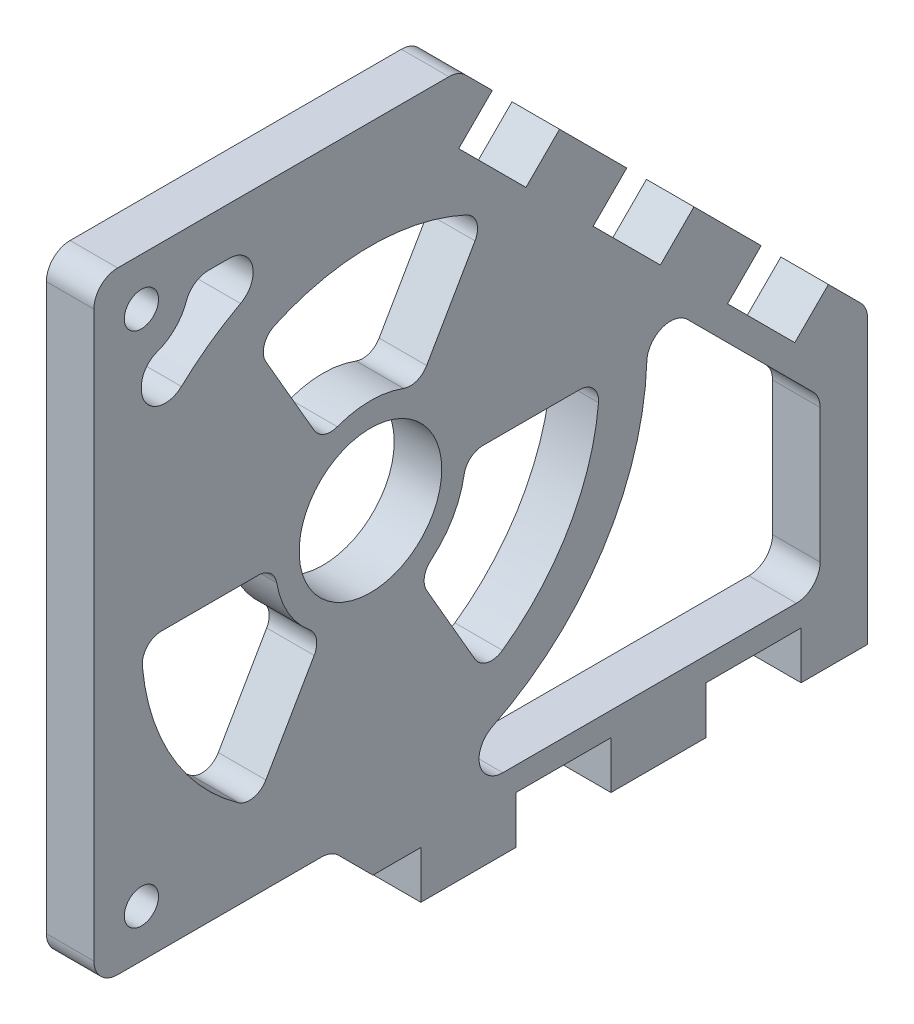
from build123d import *

# Parameters (mm, degrees)
SKETCH2_R           = 2.286
MAIN_DEPTH          = 6.35
SKETCH5_W           = 12.7
SKETCH5_H           = 6.35
SKETCH5_H_2         = 35.219317332
ACRYLIC_JOINT_DEPTH = 123.31992325
SKETCH6_W           = 3.81
SKETCH6_H           = 39.029317332
CUT_EXTRUDE1_DEPTH  = 123.31992325
FILLET4_R           = 3.175
SKETCH7_R           = 9.525
CUT_EXTRUDE2_DEPTH  = 123.31992325
FILLET5_R           = 2.54
CUT_EXTRUDE3_DEPTH  = 123.31992325
FILLET6_R           = 3.175


with BuildPart() as part:
    # Sketch2 → Main (new body)
    with BuildSketch(Plane(origin=(0, 0, 0), x_dir=(0, 0, -1), z_dir=(1, 0, 0))):
        Polygon((-67.818, 101.6), (-67.818, 19.812), (-36.068, 19.812), (-29.718, 13.462), (-29.718, 7.9375), (-24.1935, 7.9375), (45.72, 7.9375), (52.07, 7.9375), (52.07, 30.456817332), (-19.073182668, 101.6), (-55.118, 101.6), align=None)
        with Locations((-61.468, 26.162)):
            Circle(SKETCH2_R, mode=Mode.SUBTRACT)
        with Locations((-61.468, 95.25)):
            Circle(SKETCH2_R, mode=Mode.SUBTRACT)
    extrude(amount=MAIN_DEPTH)

    # Sketch5 → Acrylic Joint (cut, through all)
    with BuildSketch(Plane(origin=(6.35, 0, 0), x_dir=(0, 0, -1), z_dir=(1, 0, 0))):
        with Locations((-30.48, 11.1125)):
            Rectangle(SKETCH5_W, SKETCH5_H)
        with Locations((-5.08, 11.1125)):
            Rectangle(SKETCH5_W, SKETCH5_H)
        with Locations((20.32, 11.1125)):
            Rectangle(SKETCH5_W, SKETCH5_H)
        Polygon((16.847841816, 56.698719395), (21.337969877, 61.188847455), (30.318225998, 52.208591334), (25.828097937, 47.718463274), align=None)
        Polygon((-1.112670426, 74.659231637), (3.377457634, 79.149359697), (12.357713756, 70.169103576), (7.867585695, 65.678975516), align=None)
        Polygon((-19.073182668, 92.619743879), (-14.583054608, 97.109871939), (-5.602798487, 88.129615818), (-10.092926547, 83.639487758), align=None)
        with Locations((45.72, 25.547158666)):
            Rectangle(SKETCH5_W, SKETCH5_H_2)
    extrude(amount=-ACRYLIC_JOINT_DEPTH, mode=Mode.SUBTRACT)

    # Sketch6 → Cut-Extrude1 (cut, through all)
    with BuildSketch(Plane(origin=(6.35, 0, 0), x_dir=(0, 0, -1), z_dir=(1, 0, 0))):
        with Locations((37.465, 27.452158666)):
            Rectangle(SKETCH6_W, SKETCH6_H)
    extrude(amount=-CUT_EXTRUDE1_DEPTH, mode=Mode.SUBTRACT)

    # Fillet4
    fillet4_edges = [part.edges().sort_by_distance(p)[0] for p in [
        (3.175, 101.6, 67.818),
        (3.175, 19.812, 67.818),
        (3.175, 19.812, 36.068),
        (3.175, 101.6, 19.073182668),
        (3.175, 46.966817332, -35.56),
    ]]
    fillet(fillet4_edges, radius=FILLET4_R)

    # Sketch7 → Cut-Extrude2 (cut, through all)
    with BuildSketch(Plane(origin=(6.35, 0, 0), x_dir=(0, 0, -1), z_dir=(1, 0, 0))):
        with Locations((-30.869322709, 56.652691443)):
            Circle(SKETCH7_R)
        with BuildLine():
            Line((-46.168661354, 83.151923299), (-37.219322709, 67.651214071))
            ThreePointArc((-37.219322709, 67.651214071), (-30.869322709, 69.352691443), (-24.519322709, 67.651214071))
            Line((-24.519322709, 67.651214071), (-15.569984063, 83.151923299))
            ThreePointArc((-15.569984063, 83.151923299), (-30.869322709, 87.251368734), (-46.168661354, 83.151923299))
        make_face()
        with BuildLine():
            Line((-18.169322709, 56.652691443), (-0.270645417, 56.652691443))
            ThreePointArc((-0.270645417, 56.652691443), (-4.370090852, 41.353352797), (-15.569984063, 30.153459586))
            Line((-15.569984063, 30.153459586), (-24.519322709, 45.654168815))
            ThreePointArc((-24.519322709, 45.654168815), (-19.870800081, 50.302691443), (-18.169322709, 56.652691443))
        make_face()
        with BuildLine():
            Line((-46.168661354, 30.153459586), (-37.219322709, 45.654168815))
            ThreePointArc((-37.219322709, 45.654168815), (-41.867845337, 50.302691443), (-43.569322709, 56.652691443))
            Line((-43.569322709, 56.652691443), (-61.468, 56.652691443))
            ThreePointArc((-61.468, 56.652691443), (-57.368554565, 41.353352797), (-46.168661354, 30.153459586))
        make_face()
    extrude(amount=-CUT_EXTRUDE2_DEPTH, mode=Mode.SUBTRACT)

    # Fillet5
    fillet5_edges = [part.edges().sort_by_distance(p)[0] for p in [
        (3.175, 56.652691443, 0.270645417),
        (3.175, 83.151923299, 15.569984063),
        (3.175, 45.654168815, 37.219322709),
        (3.175, 56.652691443, 43.569322709),
        (3.175, 30.153459586, 46.168661354),
        (3.175, 30.153459586, 15.569984063),
        (3.175, 67.651214071, 24.519322709),
        (3.175, 67.651214071, 37.219322709),
        (3.175, 45.654168815, 24.519322709),
        (3.175, 56.652691443, 18.169322709),
        (3.175, 56.652691443, 61.468),
        (3.175, 83.151923299, 46.168661354),
    ]]
    fillet(fillet5_edges, radius=FILLET5_R)

    # Sketch8 → Cut-Extrude3 (cut, through all)
    with BuildSketch(Plane(origin=(6.35, 0, 0), x_dir=(0, 0, -1), z_dir=(1, 0, 0))):
        with BuildLine():
            Line((5.411759707, 63.644673443), (29.21, 39.84643315))
            Line((29.21, 39.84643315), (29.21, 17.4625))
            Line((29.21, 17.4625), (-13.182732741, 17.4625))
            ThreePointArc((-13.182732741, 17.4625), (-16.275388468, 19.919095134), (-14.582278518, 23.487394141))
            ThreePointArc((-14.582278518, 23.487394141), (2.206404856, 40.184510013), (5.411759707, 63.644673443))
        make_face()
        with BuildLine():
            Line((-61.468, 88.9), (-61.468, 77.363212962))
            ThreePointArc((-61.468, 77.363212962), (-55.574291457, 84.127575842), (-48.223979163, 89.27202088))
            ThreePointArc((-48.223979163, 89.27202088), (-46.634673715, 92.843494077), (-49.715264868, 95.25))
            Line((-49.715264868, 95.25), (-55.118, 95.25))
            ThreePointArc((-55.118, 95.25), (-56.977871939, 90.759871939), (-61.468, 88.9))
        make_face()
    extrude(amount=-CUT_EXTRUDE3_DEPTH, mode=Mode.SUBTRACT)

    # Fillet6
    fillet6_edges = [part.edges().sort_by_distance(p)[0] for p in [
        (3.175, 17.4625, -29.21),
        (3.175, 39.84643315, -29.21),
        (3.175, 63.644673443, -5.411759707),
        (3.175, 77.363212962, 61.468),
        (3.175, 88.9, 61.468),
        (3.175, 95.25, 55.118),
    ]]
    fillet(fillet6_edges, radius=FILLET6_R)


solid = part.part
